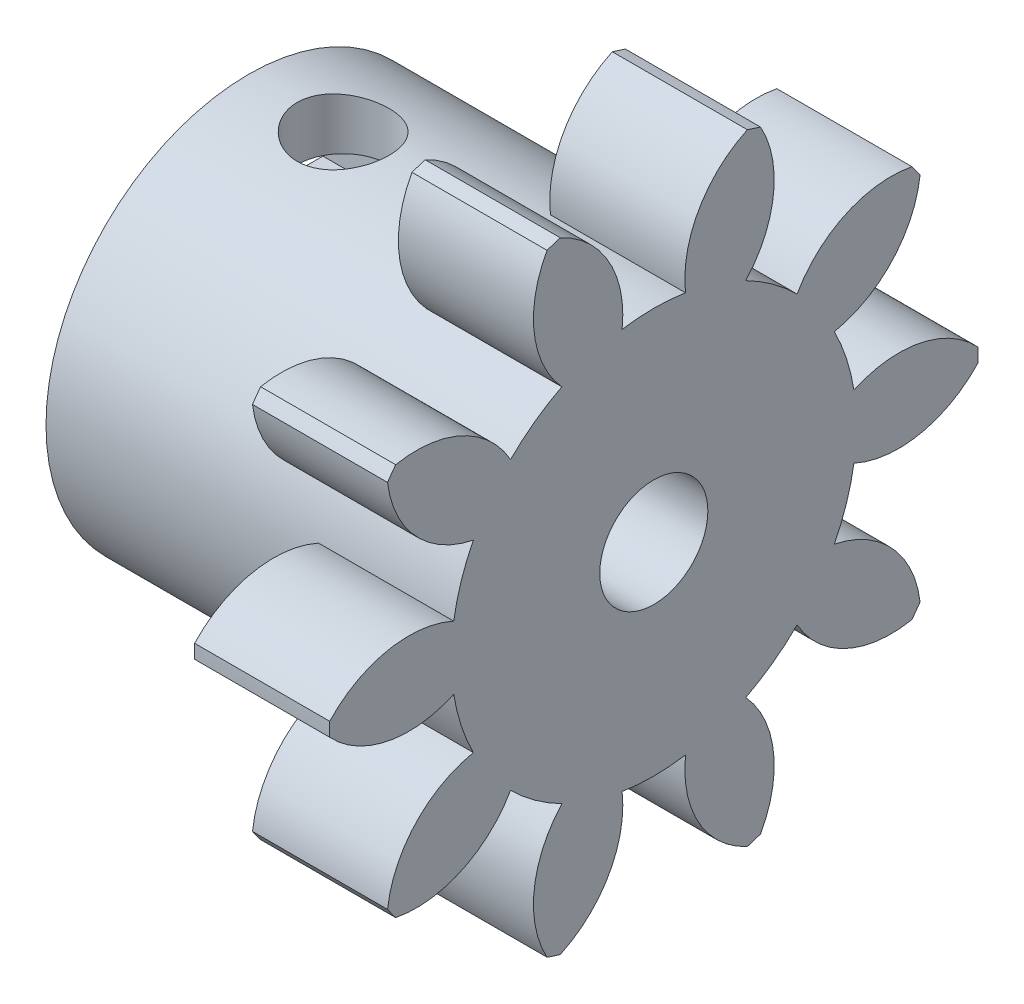
from build123d import *
from build123d.topology import SkipClean

# Parameters (mm, degrees)
BASPROSKE_W             = 10
BASPROSKE_H             = 12
TOOTHCUT_DEPTH          = 20.697715604
TEETHCUTS_COUNT         = 10
TEETHCUTS_ANGLE         = 324
HUBNEARONE_START        = 10.0000508
HUBNEAONESKE_R          = 7.499
HUBNEARONE_DEPTH        = 10.0000508
BORSKE_R                = 2
BORE_DEPTH              = 20.0000508
ESQUISSE1_W             = 5.5
ESQUISSE1_H             = 2
ENL_V_MAT_EXTRU_1_DEPTH = 7
ENL_V_MAT_EXTRU_2_REACH = 23.649
ESQUISSE6_R             = 1.7
ESQUISSE7_R             = 12
ENL_V_MAT_EXTRU_3_DEPTH = 5


with BuildPart() as part:
    # BasProSke → Base-Revolve (revolve)
    with BuildSketch(Plane(origin=(0, 0, 0), x_dir=(1, 0, 0), z_dir=(0, 1, 0))):
        with Locations((5, 6)):
            Rectangle(BASPROSKE_W, BASPROSKE_H)
    revolve(axis=Axis((-10, 0, 0), (1, 0, 0)))

    # TooCutSke → ToothCut (cut, through all)
    with BuildSketch(Plane(origin=(0, 0, 0), x_dir=(0, 0, -1), z_dir=(1, 0, 0))):
        with BuildLine():
            ThreePointArc((1.173662691, 7.406586048), (0, 7.499), (-1.173662691, 7.406586048))
            ThreePointArc((-1.173662691, 7.406586048), (-1.668191438, 9.834565786), (-3.497907776, 11.50542856))
            ThreePointArc((-3.497907776, 11.50542856), (0, 12.0254), (3.497907776, 11.50542856))
            ThreePointArc((3.497907776, 11.50542856), (1.668191438, 9.834565786), (1.173662691, 7.406586048))
        make_face()
    toothcut = extrude(amount=TOOTHCUT_DEPTH, mode=Mode.SUBTRACT)

    # TeethCuts: ToothCut ×10 about axis
    teethcuts_axis = Axis((-10, 0, 0), (1, 0, 0))
    for i in range(1, TEETHCUTS_COUNT):
        add(toothcut.rotate(teethcuts_axis, i * TEETHCUTS_ANGLE / (TEETHCUTS_COUNT - 1)), mode=Mode.SUBTRACT)

    # HubNeaOneSke → HubNearOne (add)
    with SkipClean():  # the faces are left unmerged after this step: merging them gives an invalid solid
        with BuildSketch(Plane.ZY.offset(HUBNEARONE_START)):
            Circle(HUBNEAONESKE_R)
        extrude(amount=-HUBNEARONE_DEPTH)

    # BorSke → Bore (cut, symmetric)
    with SkipClean():  # the faces are left unmerged after this step: merging them gives an invalid solid
        with BuildSketch(Plane(origin=(0, 0, 0), x_dir=(0, 0, -1), z_dir=(1, 0, 0))):
            Circle(BORSKE_R)
        extrude(amount=BORE_DEPTH, both=True, mode=Mode.SUBTRACT)

    # Esquisse1 → Enlèv. mat.-Extru.1 (cut)
    with SkipClean():  # the faces are left unmerged after this step: merging them gives an invalid solid
        with BuildSketch(Plane.ZY.offset(10.0000508)):
            with Locations((0, 4.5)):
                Rectangle(ESQUISSE1_W, ESQUISSE1_H)
        extrude(amount=-ENL_V_MAT_EXTRU_1_DEPTH, mode=Mode.SUBTRACT)

    # Esquisse4 → Dégagement M31 (revolve, cut)
    with SkipClean():  # the faces are left unmerged after this step: merging them gives an invalid solid
        with BuildSketch(Plane(origin=(-6.5000508, 3.5, 0), x_dir=(0, 0, 1), z_dir=(1, 0, 0))):
            Polygon((0, 0), (0, 4.021463052), (1.7, 3), (1.7, 0), align=None)
        revolve(axis=Axis((-6.5000508, 9.85, 0), (0, -1, 0)), mode=Mode.SUBTRACT)

    # Esquisse6 → Enlèv. mat.-Extru.2 (cut, up to next)
    with BuildSketch(Plane(origin=(0, 3.5, 0), x_dir=(-1, 0, 0), z_dir=(0, 1, 0)), mode=Mode.PRIVATE) as enl_v_mat_extru_2_sk1:
        with Locations((6.5000508, 0)):
            Circle(ESQUISSE6_R)
    enl_v_mat_extru_2_tool1 = extrude(enl_v_mat_extru_2_sk1.sketch, amount=ENL_V_MAT_EXTRU_2_REACH, mode=Mode.PRIVATE) & part.part
    add(enl_v_mat_extru_2_tool1.solids().sort_by_distance((-6.500051, 3.5, 0))[0], mode=Mode.SUBTRACT)

    # Esquisse7 → Enlèv. mat.-Extru.3 (cut)
    with SkipClean():  # the faces are left unmerged after this step: merging them gives an invalid solid
        with BuildSketch(Plane(origin=(10, 0, 0), x_dir=(0, 0, -1), z_dir=(1, 0, 0))):
            Circle(ESQUISSE7_R)
        extrude(amount=-ENL_V_MAT_EXTRU_3_DEPTH, mode=Mode.SUBTRACT)


solid = part.part
